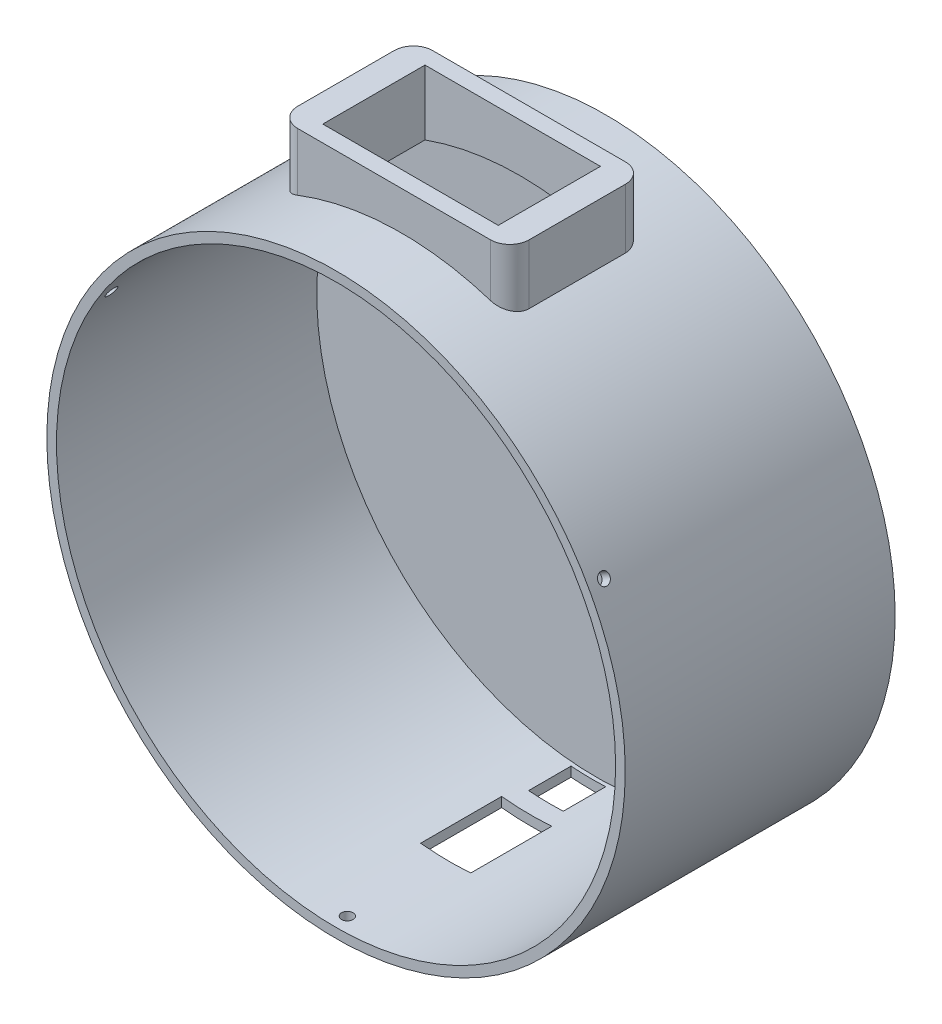
from build123d import *

# Parameters (mm, degrees)
SZKIC1_R                    = 75
DODANIE_WYCI_GNI_CIE1_DEPTH = 70
SKORUPA1_T                  = -2.5
SZKIC3_W                    = 13
SZKIC3_H                    = 21
WYTNIJ_WYCI_GNI_CIE1_DEPTH  = 60
SZKIC4_W                    = 9
SZKIC4_H                    = 11
WYTNIJ_WYCI_GNI_CIE2_DEPTH  = 60
SZKIC5_R                    = 1.5
WYTNIJ_WYCI_GNI_CIE3_DEPTH  = 60
SZYK_KO_OWY1_COUNT          = 3
DODANIE_WYCI_GNI_CIE2_REACH = 192.066
SZKIC7_W                    = 60
SZKIC7_H                    = 35
SZKIC8_W                    = 45.5
SZKIC8_H                    = 26.5
WYTNIJ_WYCI_GNI_CIE4_DEPTH  = 30
ZAOKR_GLENIE1_R             = 5


with BuildPart() as part:
    # Szkic1 → Dodanie-wyciągnięcie1 (new body)
    with BuildSketch(Plane.XY):
        Circle(SZKIC1_R)
    extrude(amount=DODANIE_WYCI_GNI_CIE1_DEPTH)

    # Skorupa1
    skorupa1_openings = [part.faces().sort_by_distance(p)[0] for p in [
        (0, 0, 70),
    ]]
    offset(amount=SKORUPA1_T, openings=skorupa1_openings, kind=Kind.INTERSECTION)

    # Szkic3 → Wytnij-wyciągnięcie1 (cut)
    with BuildSketch(Plane(origin=(0, -75, 0), x_dir=(-1, 0, 0), z_dir=(0, -1, 0))):
        with Locations((1.061442615, -30)):
            Rectangle(SZKIC3_W, SZKIC3_H)
    extrude(amount=-WYTNIJ_WYCI_GNI_CIE1_DEPTH, mode=Mode.SUBTRACT)

    # Szkic4 → Wytnij-wyciągnięcie2 (cut)
    with BuildSketch(Plane(origin=(0, -75, 0), x_dir=(-1, 0, 0), z_dir=(0, -1, 0))):
        with Locations((1.061442615, -9)):
            Rectangle(SZKIC4_W, SZKIC4_H)
    extrude(amount=-WYTNIJ_WYCI_GNI_CIE2_DEPTH, mode=Mode.SUBTRACT)

    # Szkic5 → Wytnij-wyciągnięcie3 (cut)
    with BuildSketch(Plane(origin=(0, -75, 0), x_dir=(-1, 0, 0), z_dir=(0, -1, 0))):
        with Locations((1.061442615, -66)):
            Circle(SZKIC5_R)
    wytnij_wyci_gni_cie3 = extrude(amount=-WYTNIJ_WYCI_GNI_CIE3_DEPTH, mode=Mode.SUBTRACT)

    # Szyk kołowy1: Wytnij-wyciągnięcie3 ×3 about axis
    szyk_ko_owy1_axis = Axis((0, 0, 70), (0, 0, 1))
    for i in range(1, SZYK_KO_OWY1_COUNT):
        add(wytnij_wyci_gni_cie3.rotate(szyk_ko_owy1_axis, i * 360 / SZYK_KO_OWY1_COUNT), mode=Mode.SUBTRACT)

    # Szkic7 → Dodanie-wyciągnięcie2 (add, up to next)
    with BuildSketch(Plane(origin=(0, 85, 0), x_dir=(-1, 0, 0), z_dir=(0, -1, 0)), mode=Mode.PRIVATE) as dodanie_wyci_gni_cie2_sk1:
        with Locations((1.900639924, -35.532003496)):
            Rectangle(SZKIC7_W, SZKIC7_H)
    dodanie_wyci_gni_cie2_tool1 = extrude(dodanie_wyci_gni_cie2_sk1.sketch, amount=DODANIE_WYCI_GNI_CIE2_REACH, mode=Mode.PRIVATE) - part.part
    add(dodanie_wyci_gni_cie2_tool1.solids().sort_by_distance((-1.90064, 85, 35.532003))[0])

    # Szkic8 → Wytnij-wyciągnięcie4 (cut)
    with BuildSketch(Plane(origin=(0, 85, 0), x_dir=(1, 0, 0), z_dir=(0, 1, 0))):
        with Locations((-1.900639924, -35.532003496)):
            Rectangle(SZKIC8_W, SZKIC8_H)
    extrude(amount=-WYTNIJ_WYCI_GNI_CIE4_DEPTH, mode=Mode.SUBTRACT)

    # Zaokrąglenie1
    zaokr_glenie1_edges = [part.edges().sort_by_distance(p)[0] for p in [
        (28.099360076, 77.268613588, 53.032003496),
        (28.099360076, 77.268613588, 18.032003496),
        (-31.900639924, 76.438728514, 53.032003496),
        (-31.900639924, 76.438728514, 18.032003496),
    ]]
    fillet(zaokr_glenie1_edges, radius=ZAOKR_GLENIE1_R)


solid = part.part
